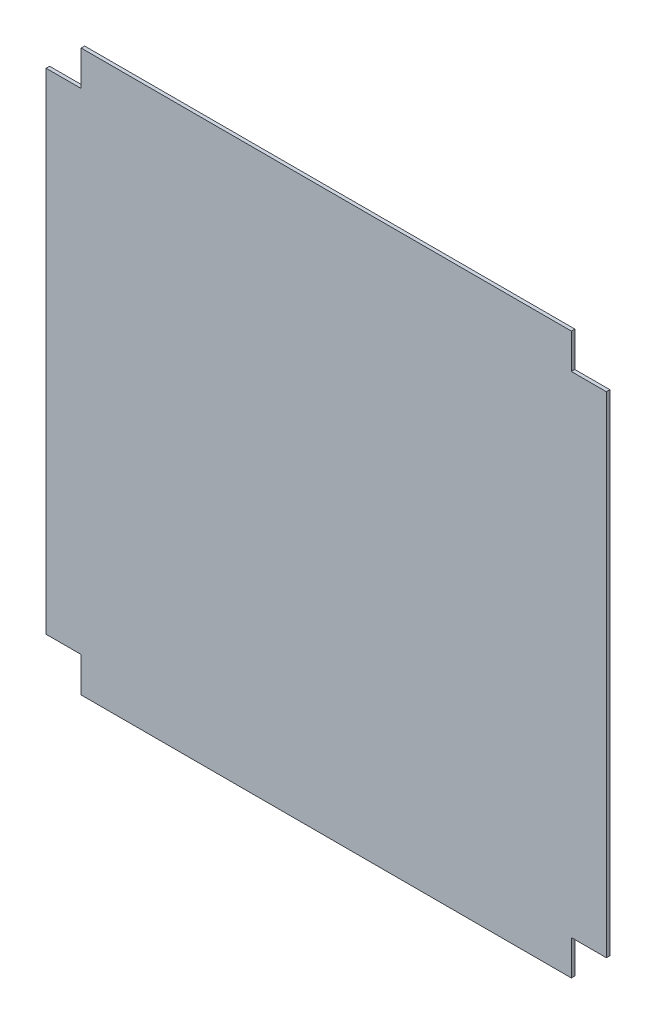
from build123d import *

# Parameters (mm, degrees)
BOSS_EXTRUDE1_DEPTH = 2


with BuildPart() as part:
    # Sketch1 → Boss-Extrude1 (new body)
    with BuildSketch(Plane(origin=(0, 0, 0), x_dir=(0, 1, 0), z_dir=(0, 0, 1))):
        Polygon((300, -20), (300, 0), (20, 0), (20, -20), (0, -20), (0, -300), (20, -300), (20, -320), (300, -320), (300, -300), (320, -300), (320, -20), align=None)
    extrude(amount=BOSS_EXTRUDE1_DEPTH)


solid = part.part
